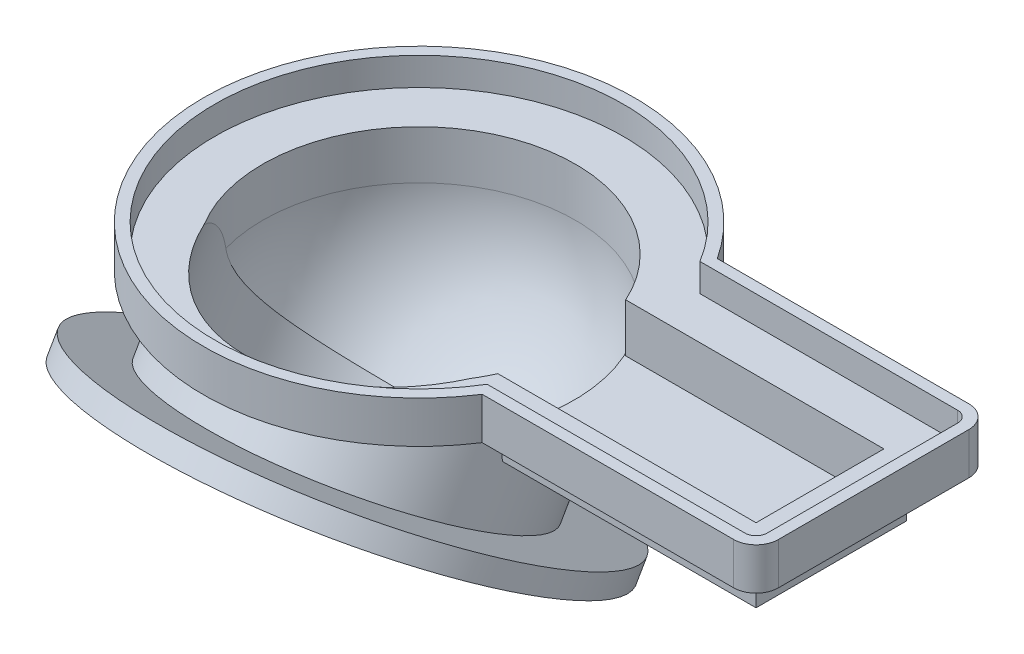
from build123d import *

# Parameters (mm, degrees)
BOSS_EXTRUDE1_DEPTH     = 3.175
EXTRUDE_THIN1_START     = 7.874
EXTRUDE_THIN1_DEPTH     = 7.874
BOSS_EXTRUDE2_DEPTH     = 3.175
EXTRUDE_THIN2_REACH     = 134.494
SKETCH7_R               = 36.861935
SKETCH7_R_2             = 34.321935
CUT_EXTRUDE1_DEPTH      = 44.45
CUT_EXTRUDE1_DEPTH_BACK = 13.335
SKETCH8_R               = 34.321935
SKETCH10_R              = 50.8
SKETCH10_R_2            = 34.321935
BOSS_EXTRUDE3_DEPTH     = 5.08
FILLET1_START           = -1
FILLET1_DEPTH           = 5
BOSS_EXTRUDE4_START     = -3.175
BOSS_EXTRUDE4_DEPTH     = 9.525


with BuildPart() as part:
    # Sketch1 → Boss-Extrude1 (new body)
    with BuildSketch(Plane(origin=(0, 0, 0), x_dir=(1, 0, 0), z_dir=(0, 1, 0))):
        with BuildLine():
            Line((39.687895, -24.196019), (100.838, -24.196019))
            Line((100.838, -24.196019), (100.838, 24.196019))
            Line((100.838, 24.196019), (39.687895, 24.196019))
            ThreePointArc((39.687895, 24.196019), (-46.482, 0), (39.687895, -24.196019))
        make_face()
        with BuildLine():
            Line((32.449732, -14.544019), (91.186, -14.544019))
            Line((91.186, -14.544019), (91.186, 14.544019))
            Line((91.186, 14.544019), (32.449732, 14.544019))
            ThreePointArc((32.449732, 14.544019), (-35.56, 0), (32.449732, -14.544019))
        make_face(mode=Mode.SUBTRACT)
    extrude(amount=BOSS_EXTRUDE1_DEPTH)

    # Sketch4 → Extrude-Thin1 (add)
    with BuildSketch(Plane.XZ.offset(EXTRUDE_THIN1_START)):
        with BuildLine():
            Line((34.055048, 17.084019), (93.726, 17.084019))
            Line((93.726, 17.084019), (93.726, -17.084019))
            Line((93.726, -17.084019), (34.055048, -17.084019))
            ThreePointArc((34.055048, -17.084019), (-38.1, 0), (34.055048, 17.084019))
        make_face()
        with BuildLine():
            Line((32.449732, 14.544019), (91.186, 14.544019))
            Line((91.186, 14.544019), (91.186, -14.544019))
            Line((91.186, -14.544019), (32.449732, -14.544019))
            ThreePointArc((32.449732, -14.544019), (-35.56, 0), (32.449732, 14.544019))
        make_face(mode=Mode.SUBTRACT)
    extrude(amount=-EXTRUDE_THIN1_DEPTH)

    # Sketch5 → Revolve1 (revolve)
    with BuildSketch(Plane.XY):
        with BuildLine():
            Line((0, -43.434), (0, -45.974))
            ThreePointArc((0, -45.974), (-26.940768, -34.814768), (-38.1, -7.874))
            Line((-38.1, -7.874), (-35.56, -7.874))
            ThreePointArc((-35.56, -7.874), (-25.144717, -33.018717), (0, -43.434))
        make_face()
    revolve(axis=Axis((0, -50.818528, 0), (0, 1, 0)))

    # Sketch6 → Boss-Extrude2 (add)
    with BuildSketch(Plane.XZ.offset(7.874)):
        with BuildLine():
            Line((30.889366, -17.084019), (93.726, -17.084019))
            Line((93.726, -17.084019), (93.726, 17.084019))
            Line((93.726, 17.084019), (30.889366, 17.084019))
            ThreePointArc((30.889366, 17.084019), (35.298961, 0), (30.889366, -17.084019))
        make_face()
    extrude(amount=BOSS_EXTRUDE2_DEPTH)

    # Sketch7 → Extrude-Thin2 (add, up to next)
    with BuildSketch(Plane(origin=(0, -20.306958, 35.540261), x_dir=(1, 0, 0), z_dir=(0, 0.8661855860486005, -0.49972245348957706)), mode=Mode.PRIVATE) as extrude_thin2_sk1:
        with Locations((0, 19.05)):
            Circle(SKETCH7_R)
        with Locations((0, 19.05)):
            Circle(SKETCH7_R_2, mode=Mode.SUBTRACT)
    extrude_thin2_tool1 = extrude(extrude_thin2_sk1.sketch, amount=EXTRUDE_THIN2_REACH, mode=Mode.PRIVATE) - part.part
    add(extrude_thin2_tool1.solids().sort_by_distance((-35.819322, -29.826671, 19.039425))[0])

    # Sketch8 → Cut-Extrude1 (cut, two sides: drawn at the far end of the back side and taken through both)
    with BuildSketch(Plane(origin=(0, -20.306958, 35.540261), x_dir=(1, 0, 0), z_dir=(0, 0.8661855860486005, -0.49972245348957706)).offset(-CUT_EXTRUDE1_DEPTH_BACK)):
        with Locations(Location((0, 19.05, 0), (0, 0, 359.940086))):
            Circle(SKETCH8_R)
    extrude(amount=CUT_EXTRUDE1_DEPTH + CUT_EXTRUDE1_DEPTH_BACK, mode=Mode.SUBTRACT)

    # Sketch10 → Boss-Extrude3 (add)
    with BuildSketch(Plane(origin=(0, -30.61954, 17.665119), x_dir=(1, 0, 0), z_dir=(0, -0.8661855860486006, 0.49972245348957695))):
        with Locations(Location((0, 0, 0), (0, 0, 270))):
            Circle(SKETCH10_R)
        with Locations(Location((0, 1.586619, 0), (0, 0, 0.059914))):
            Circle(SKETCH10_R_2, mode=Mode.SUBTRACT)
    extrude(amount=-BOSS_EXTRUDE3_DEPTH)

    # Fillet1: read off the stored shape, not the designer's step
    # Fillet1 outline → Fillet1 (cut)
    with BuildSketch(Plane(origin=(0, 0, 0), x_dir=(1, 0, 0), z_dir=(0, 1, 0)).offset(FILLET1_START)):
        with BuildLine():
            Line((100.838, -24.196019), (100.838, -21.656019))
            ThreePointArc((100.838, -21.656019), (100.094051, -23.45207), (98.298, -24.196019))
            Line((98.298, -24.196019), (100.838, -24.196019))
        make_face()
        with BuildLine():
            ThreePointArc((98.298, 24.196019), (100.094051, 23.45207), (100.838, 21.656019))
            Line((100.838, 21.656019), (100.838, 24.196019))
            Line((100.838, 24.196019), (98.298, 24.196019))
        make_face()
    extrude(amount=FILLET1_DEPTH, mode=Mode.SUBTRACT)

    # Boss-Extrude4: read off the stored shape, not the designer's step
    # Boss-Extrude4 outline → Boss-Extrude4 (add)
    with BuildSketch(Plane(origin=(0, 3.175, 0), x_dir=(1, 0, 0), z_dir=(0, 1, 0)).offset(BOSS_EXTRUDE4_START)):
        with BuildLine():
            ThreePointArc((41.089436, 26.736019), (-49.022, 0), (41.089436, -26.736019))
            Line((41.089436, -26.736019), (98.298, -26.736019))
            ThreePointArc((98.298, -26.736019), (101.890102, -25.248122), (103.378, -21.656019))
            Line((103.378, -21.656019), (103.378, 21.656019))
            ThreePointArc((103.378, 21.656019), (101.890102, 25.248122), (98.298, 26.736019))
            Line((98.298, 26.736019), (41.089436, 26.736019))
        make_face()
        with BuildLine():
            Line((98.298, -24.196019), (39.687895, -24.196019))
            ThreePointArc((39.687895, -24.196019), (-46.482, 0), (39.687895, 24.196019))
            Line((39.687895, 24.196019), (98.298, 24.196019))
            ThreePointArc((98.298, 24.196019), (100.094051, 23.45207), (100.838, 21.656019))
            Line((100.838, 21.656019), (100.838, -21.656019))
            ThreePointArc((100.838, -21.656019), (100.094051, -23.45207), (98.298, -24.196019))
        make_face(mode=Mode.SUBTRACT)
    extrude(amount=BOSS_EXTRUDE4_DEPTH)


solid = part.part
